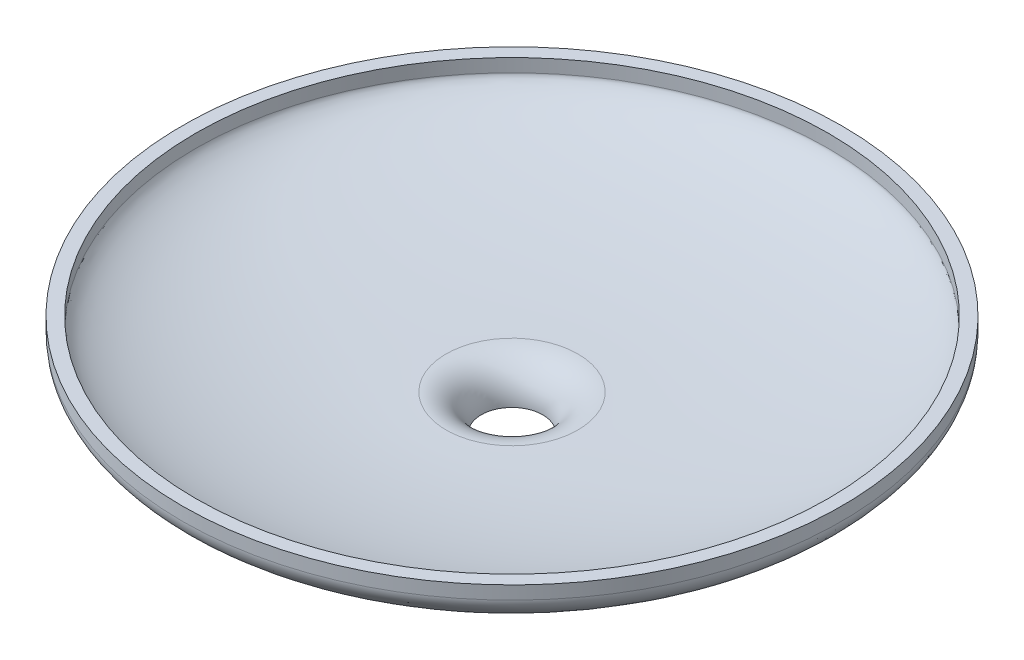
from build123d import *


with BuildPart() as part:
    # Sketch2 → Revolve1 (revolve)
    with BuildSketch(Plane.XY):
        with BuildLine():
            Line((-72, 23), (-72, 20))
            add(Edge.make_bspline(
                [(-72, 20), (-72, 19.947212132), (-71.991302247, 19.8539678), (-71.915687216, 19.575290497), (-71.600554516, 18.993243561), (-70.616287871, 17.984302576), (-68.441283898, 16.45124519), (-64.185692662, 14.440161315), (-56.986209284, 12.243195523), (-48.062270178, 10.410011287), (-37.80428281, 9.038495397), (-28.494536676, 8.332339867), (-20.818234906, 8.047644164), (-16.935873396, 8), (-15, 8)],
                knots=[3.141592654, 3.141592654, 3.141592654, 3.141592654, 3.190680039, 3.239767424, 3.337942194, 3.436116965, 3.534291735, 3.730641276, 3.926990817, 4.123340358, 4.319689899, 4.51603944, 4.61421421, 4.71238898, 4.71238898, 4.71238898, 4.71238898], degree=3))
            ThreePointArc((-15, 8), (-9.343145751, 5.656854249), (-7, 0))
            Line((-7, 0), (-10, 0))
            ThreePointArc((-10, 0), (-11.464466094, 3.535533906), (-15, 5))
            add(Edge.make_bspline(
                [(-75, 20), (-75, 5), (-15, 5)],
                knots=[3.141592654, 3.141592654, 3.141592654, 4.71238898, 4.71238898, 4.71238898], degree=2, weights=[1, 0.707106781, 1]))
            Line((-75, 20), (-75, 23))
            Line((-75, 23), (-72, 23))
        make_face()
    revolve(axis=Axis((0, 0, 0), (0, 1, 0)))


solid = part.part
